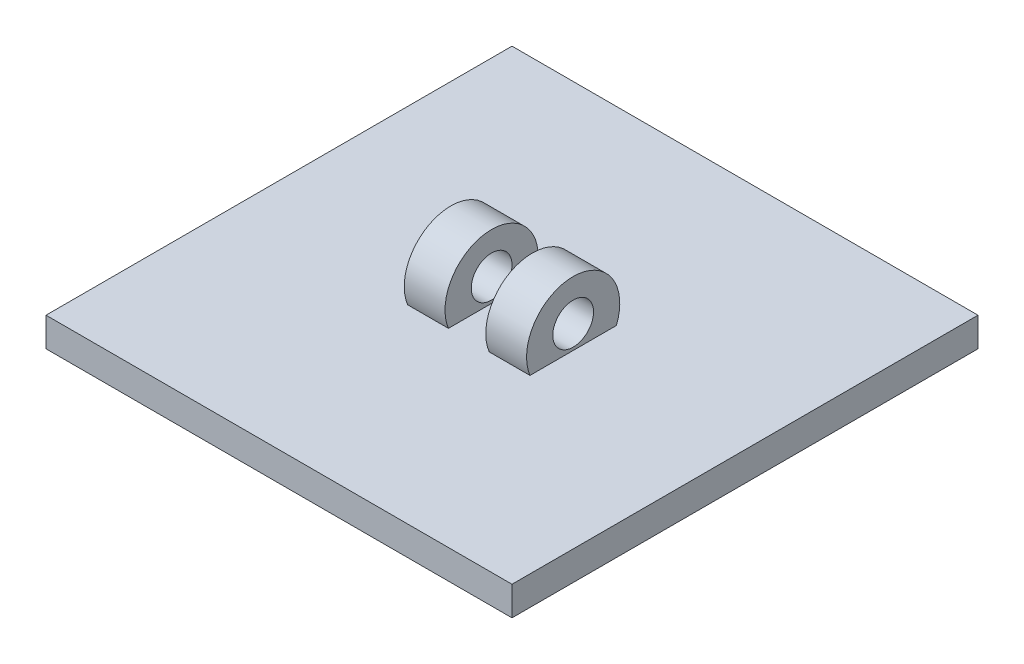
from build123d import *

# Parameters (mm, degrees)
SKETCH2_W           = 80
SKETCH2_H           = 80
BOSS_EXTRUDE1_DEPTH = 5
BOSS_EXTRUDE2_DEPTH = 10.5
CUT_EXTRUDE3_DEPTH  = 3.5
SKETCH8_R           = 3.5
CUT_EXTRUDE5_DEPTH  = 67.379590237


with BuildPart() as part:
    # Sketch2 → Boss-Extrude1 (new body)
    with BuildSketch(Plane(origin=(0, 0, 0), x_dir=(1, 0, 0), z_dir=(0, 1, 0))):
        Rectangle(SKETCH2_W, SKETCH2_H)
    extrude(amount=BOSS_EXTRUDE1_DEPTH)

    # Sketch3 → Boss-Extrude2 (add, symmetric)
    with BuildSketch(Plane(origin=(0, 0, 0), x_dir=(0, 0, -1), z_dir=(1, 0, 0))):
        with BuildLine():
            ThreePointArc((0, 0), (5.656854249, 2.343145751), (8, 8))
            ThreePointArc((8, 8), (-5.656854249, 13.656854249), (0, 0))
        make_face()
    extrude(amount=BOSS_EXTRUDE2_DEPTH, both=True)

    # Sketch4 → Cut-Extrude3 (cut, symmetric)
    with BuildSketch(Plane(origin=(0, 0, 0), x_dir=(0, 0, -1), z_dir=(1, 0, 0))):
        with BuildLine():
            ThreePointArc((8, 8), (-1.5281381, 15.85269342), (-7.416198487, 5))
            Line((-7.416198487, 5), (7.416198487, 5))
            ThreePointArc((7.416198487, 5), (7.85269342, 6.4718619), (8, 8))
        make_face()
    extrude(amount=CUT_EXTRUDE3_DEPTH, both=True, mode=Mode.SUBTRACT)

    # Sketch8 → Cut-Extrude5 (cut, through all)
    with BuildSketch(Plane(origin=(10.5, 0, 0), x_dir=(0, 0, -1), z_dir=(1, 0, 0))):
        with Locations((0, 9)):
            Circle(SKETCH8_R)
    extrude(amount=-CUT_EXTRUDE5_DEPTH, mode=Mode.SUBTRACT)


solid = part.part
